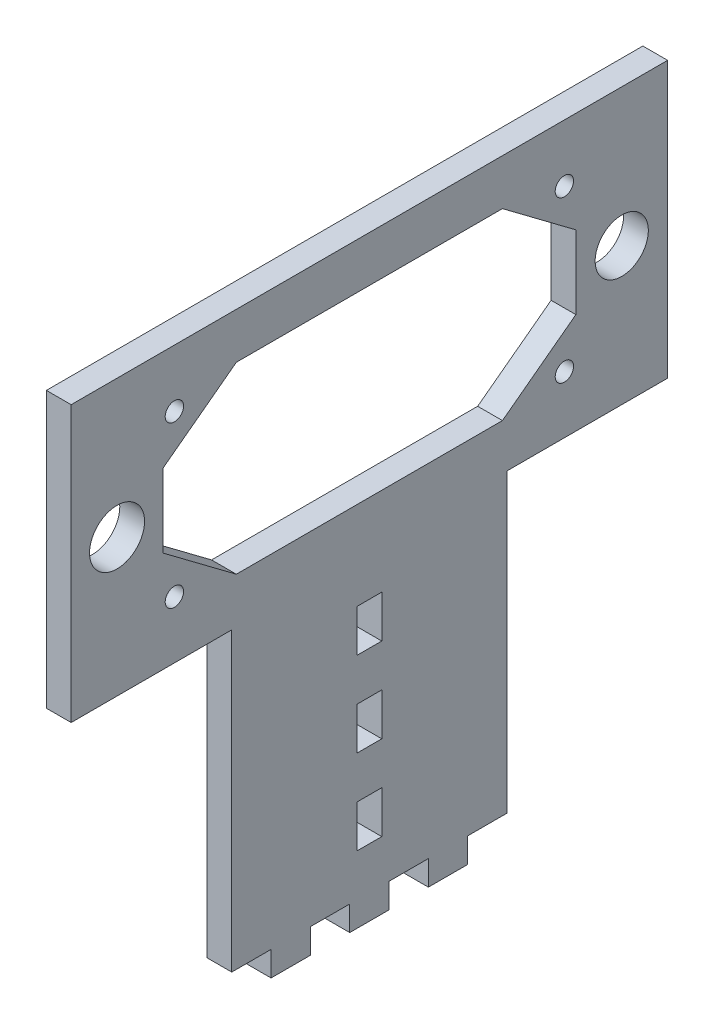
from build123d import *

# Parameters (mm, degrees)
SKETCH1_R           = 1
SKETCH1_R_2         = 3
SKETCH1_R_3         = 2.9
SKETCH1_W           = 2.7
SKETCH1_H           = 4.614285715
SKETCH1_H_2         = 4.614285714
BOSS_EXTRUDE1_DEPTH = 2.7


with BuildPart() as part:
    # Sketch1 → Boss-Extrude1 (new body)
    with BuildSketch(Plane(origin=(0, 0, 0), x_dir=(0, 0, -1), z_dir=(1, 0, 0))):
        Polygon((10.714285714, -32.5), (6.428571429, -32.5), (6.428571429, -29.8), (2.142857143, -29.8), (2.142857143, -32.5), (-2.142857143, -32.5), (-2.142857143, -29.8), (-6.428571429, -29.8), (-6.428571429, -32.5), (-10.714285714, -32.5), (-10.714285714, -29.8), (-15, -29.8), (-15, 2.5), (-32.5, 2.5), (-32.5, 32.5), (32.5, 32.5), (32.5, 2.5), (15, 2.5), (15, -29.8), (10.714285714, -29.8), align=None)
        with Locations((21.25, 26.25)):
            Circle(SKETCH1_R, mode=Mode.SUBTRACT)
        with Locations((21.25, 8.75)):
            Circle(SKETCH1_R, mode=Mode.SUBTRACT)
        with Locations((-21.25, 8.75)):
            Circle(SKETCH1_R, mode=Mode.SUBTRACT)
        with Locations((-21.25, 26.25)):
            Circle(SKETCH1_R, mode=Mode.SUBTRACT)
        with Locations((-27.5, 17.5)):
            Circle(SKETCH1_R_2, mode=Mode.SUBTRACT)
        with Locations((27.5, 17.5)):
            Circle(SKETCH1_R_3, mode=Mode.SUBTRACT)
        with Locations((0, -4.421428571)):
            Rectangle(SKETCH1_W, SKETCH1_H, mode=Mode.SUBTRACT)
        with Locations((0, -13.65)):
            Rectangle(SKETCH1_W, SKETCH1_H_2, mode=Mode.SUBTRACT)
        with Locations((0, -22.878571429)):
            Rectangle(SKETCH1_W, SKETCH1_H, mode=Mode.SUBTRACT)
        Polygon((0, 7.5), (14.5, 7.5), (22.5, 13.5), (22.5, 21.5), (14.5, 27.5), (-14.5, 27.5), (-22.5, 21.5), (-22.5, 13.5), (-14.5, 7.5), align=None, mode=Mode.SUBTRACT)
    extrude(amount=-BOSS_EXTRUDE1_DEPTH)


solid = part.part
